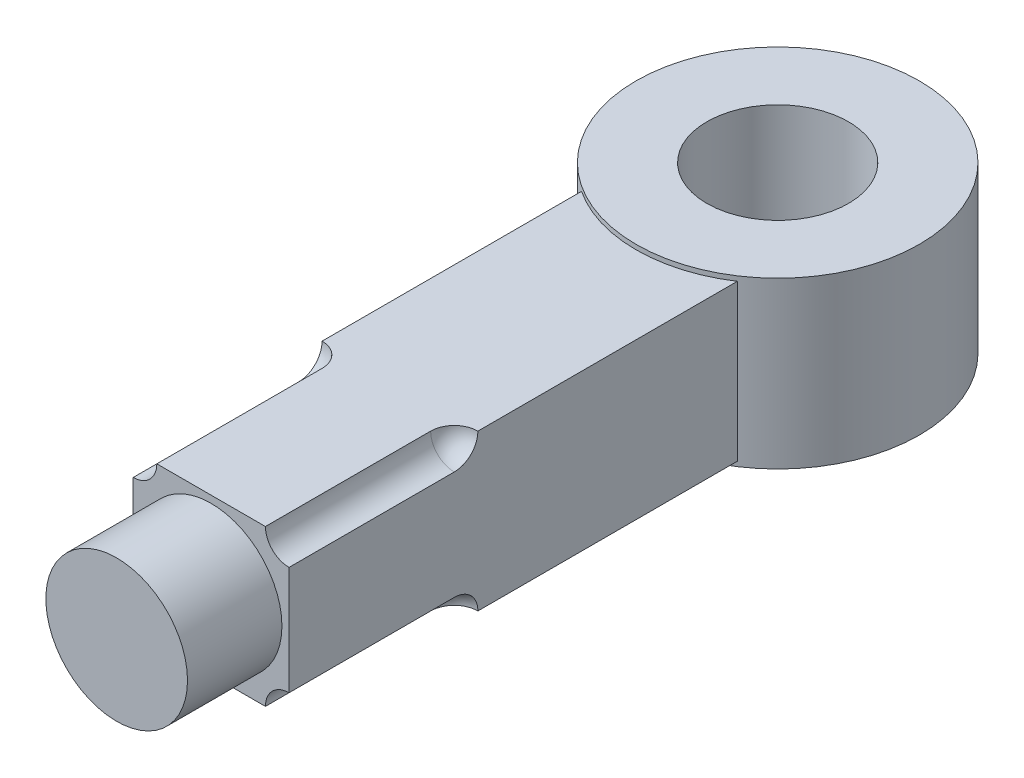
from build123d import *

# Parameters (mm, degrees)
SKETCH1_R                = 30
BOSS_EXTRUDE1_DEPTH      = 17.5
SKETCH2_W                = 33
SKETCH2_H                = 33
BOSS_EXTRUDE2_DEPTH      = 120
SKETCH3_R                = 15
BOSS_EXTRUDE3_DEPTH      = 20
HOLE1_D                  = 30
CUT_EXTRUDE1_DEPTH       = 40
FILLET1_R                = 5
CIRPATTERN1_COUNT        = 4
FILLET1_OF_CIRPATTERN1_R = 5


with BuildPart() as part:
    # Sketch1 → Boss-Extrude1 (new, symmetric)
    with BuildSketch(Plane(origin=(0, 0, 0), x_dir=(1, 0, 0), z_dir=(0, 1, 0))):
        with Locations(Location((0, 0, 0), (0, 0, 270))):
            Circle(SKETCH1_R)
    extrude(amount=BOSS_EXTRUDE1_DEPTH, both=True)

    # Sketch2 → Boss-Extrude2 (add)
    with BuildSketch(Plane.XY):
        Rectangle(SKETCH2_W, SKETCH2_H)
    extrude(amount=BOSS_EXTRUDE2_DEPTH)

    # Sketch3 → Boss-Extrude3 (add)
    with BuildSketch(Plane.XY.offset(120)):
        Circle(SKETCH3_R)
    extrude(amount=BOSS_EXTRUDE3_DEPTH)

    # Hole1 (through all)
    with Locations(Plane(origin=(0, 17.5, 0), x_dir=(1, 0, 0), z_dir=(0, 1, 0))):
        with Locations((0, 0)):
            Hole(HOLE1_D / 2)

    # Sketch6 → Cut-Extrude1 (cut)
    with BuildSketch(Plane.XY.offset(120)):
        with BuildLine():
            Line((11.5, 16.5), (16.5, 16.5))
            Line((16.5, 16.5), (16.5, 11.5))
            ThreePointArc((16.5, 11.5), (12.964466094, 12.964466094), (11.5, 16.5))
        make_face()
    cut_extrude1 = extrude(amount=-CUT_EXTRUDE1_DEPTH, mode=Mode.SUBTRACT)

    # Fillet1
    fillet1_edges = [part.edges().sort_by_distance(p)[0] for p in [
        (12.964466094, 12.964466094, 80),
    ]]
    fillet(fillet1_edges, radius=FILLET1_R - 0.0001)  # a hair under: the kernel refuses the full size

    # CirPattern1: Cut-Extrude1 ×4 about axis
    cirpattern1_axis = Axis((0, 0, 0), (0, 0, 1))
    for i in range(1, CIRPATTERN1_COUNT):
        add(cut_extrude1.rotate(cirpattern1_axis, i * 360 / CIRPATTERN1_COUNT), mode=Mode.SUBTRACT)

    # Fillet1 of CirPattern1
    fillet1_of_cirpattern1_edges = [part.edges().sort_by_distance(p)[0] for p in [
        (-12.964466094, 12.964466094, 80),
        (-12.964466094, -12.964466094, 80),
        (12.964466094, -12.964466094, 80),
    ]]
    fillet(fillet1_of_cirpattern1_edges, radius=FILLET1_OF_CIRPATTERN1_R - 0.0001)  # a hair under: the kernel refuses the full size


solid = part.part
